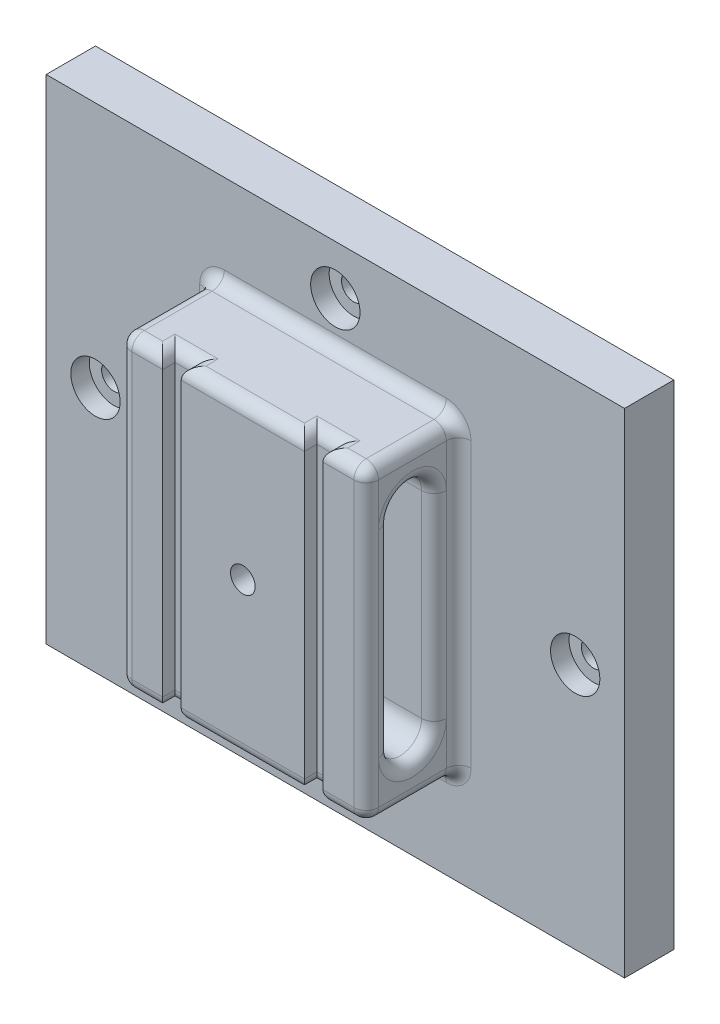
from build123d import *

# Parameters (mm, degrees)
SKETCH1_W           = 93.8
SKETCH1_H           = 80
BOSS_EXTRUDE1_DEPTH = 8
SKETCH2_W           = 40
SKETCH2_H           = 50
BOSS_EXTRUDE2_DEPTH = 15
SKETCH4_R           = 2
CUT_EXTRUDE2_DEPTH  = 66.792172787
CUT_EXTRUDE3_DEPTH  = 5
SKETCH7_R           = 2
CUT_EXTRUDE4_DEPTH  = 20
SKETCH8_R           = 4
CUT_EXTRUDE5_DEPTH  = 3
CUT_EXTRUDE6_DEPTH  = 82.268751682
SKETCH10_W          = 3
SKETCH10_H          = 50
CUT_EXTRUDE7_DEPTH  = 2
FILLET2_R           = 2


with BuildPart() as part:
    # Sketch1 → Boss-Extrude1 (new body)
    with BuildSketch(Plane.XY):
        Rectangle(SKETCH1_W, SKETCH1_H)
    extrude(amount=BOSS_EXTRUDE1_DEPTH)

    # Sketch2 → Boss-Extrude2 (add)
    with BuildSketch(Plane.XY.offset(8)):
        Rectangle(SKETCH2_W, SKETCH2_H)
    extrude(amount=BOSS_EXTRUDE2_DEPTH)

    # Sketch4 → Cut-Extrude2 (cut, through all)
    with BuildSketch(Plane(origin=(0, 0, 0), x_dir=(-1, 0, 0), z_dir=(0, 0, -1))):
        with Locations((0, -32)):
            Circle(SKETCH4_R)
        with Locations((0, 32)):
            Circle(SKETCH4_R)
        with Locations((38.9, 0)):
            Circle(SKETCH4_R)
        with Locations((-38.9, 0)):
            Circle(SKETCH4_R)
    extrude(amount=-CUT_EXTRUDE2_DEPTH, mode=Mode.SUBTRACT)

    # Sketch5 → Cut-Extrude3 (cut)
    with BuildSketch(Plane(origin=(0, 0, 0), x_dir=(-1, 0, 0), z_dir=(0, 0, -1))):
        Polygon((0, 4.001037365), (-3.465, 2.000518683), (-3.465, -2.000518683), (0, -4.001037365), (3.465, -2.000518683), (3.465, 2.000518683), align=None)
    extrude(amount=-CUT_EXTRUDE3_DEPTH, mode=Mode.SUBTRACT)

    # Sketch7 → Cut-Extrude4 (cut)
    with BuildSketch(Plane(origin=(0, 0, 5), x_dir=(-1, 0, 0), z_dir=(0, 0, -1))):
        Circle(SKETCH7_R)
    extrude(amount=-CUT_EXTRUDE4_DEPTH, mode=Mode.SUBTRACT)

    # Sketch8 → Cut-Extrude5 (cut)
    with BuildSketch(Plane.XY.offset(8)):
        with Locations((0, 32)):
            Circle(SKETCH8_R)
        with Locations((38.9, 0)):
            Circle(SKETCH8_R)
        with Locations((0, -32)):
            Circle(SKETCH8_R)
        with Locations((-38.9, 0)):
            Circle(SKETCH8_R)
    extrude(amount=-CUT_EXTRUDE5_DEPTH, mode=Mode.SUBTRACT)

    # Sketch9 → Cut-Extrude6 (cut, through all)
    with BuildSketch(Plane(origin=(20, 0, 0), x_dir=(0, 0, -1), z_dir=(1, 0, 0))):
        with BuildLine():
            Line((-12, 16), (-12, -16))
            ThreePointArc((-12, -16), (-15.5, -19.5), (-19, -16))
            Line((-19, -16), (-19, 16))
            ThreePointArc((-19, 16), (-15.5, 19.5), (-12, 16))
        make_face()
    extrude(amount=-CUT_EXTRUDE6_DEPTH, mode=Mode.SUBTRACT)

    # Sketch10 → Cut-Extrude7 (cut)
    with BuildSketch(Plane.XY.offset(23)):
        with Locations((-11.5, 0)):
            Rectangle(SKETCH10_W, SKETCH10_H)
        with Locations((11.5, 0)):
            Rectangle(SKETCH10_W, SKETCH10_H)
    extrude(amount=-CUT_EXTRUDE7_DEPTH, mode=Mode.SUBTRACT)

    # Fillet2
    fillet2_edges = [part.edges().sort_by_distance(p)[0] for p in [
        (20, 0, 23),
        (20, 0, 8),
        (20, -19.5, 15.5),
        (20, 0, 12),
        (20, 19.5, 15.5),
        (20, 0, 19),
        (0, 25, 8),
        (20, 25, 15.5),
        (16.5, 25, 23),
        (13, 25, 22),
        (11.5, 25, 21),
        (10, 25, 22),
        (0, 25, 23),
        (-10, 25, 22),
        (-11.5, 25, 21),
        (-13, 25, 22),
        (-16.5, 25, 23),
        (-20, 25, 15.5),
        (-20, 0, 23),
        (-20, 0, 8),
        (-20, -19.5, 15.5),
        (-20, 0, 19),
        (-20, 19.5, 15.5),
        (-20, 0, 12),
        (-10, -25, 22),
        (0, -25, 23),
        (10, -25, 22),
        (11.5, -25, 21),
        (13, -25, 22),
        (16.5, -25, 23),
        (20, -25, 15.5),
        (0, -25, 8),
        (-20, -25, 15.5),
        (-16.5, -25, 23),
        (-13, -25, 22),
        (-11.5, -25, 21),
    ]]
    fillet(fillet2_edges, radius=FILLET2_R - 0.0001)  # a hair under: the kernel refuses the full size


solid = part.part
